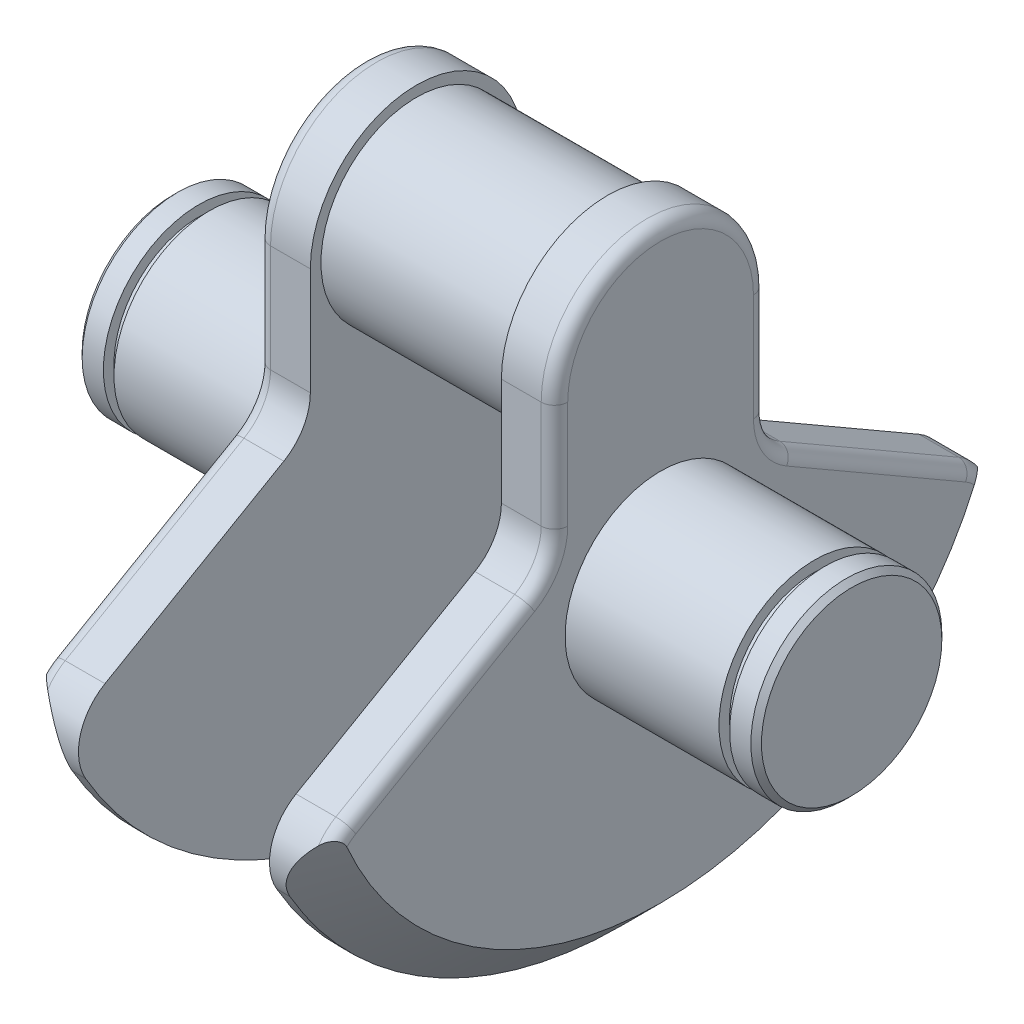
from build123d import *

# Parameters (mm, degrees)
BOSS_EXTRUDE1_DEPTH      = 10
CHAMFER1_SIZE            = 7.5
FILLET1_R                = 2.5
BOSS_EXTRUDE2_DEPTH      = 10
CHAMFER2_SIZE            = 7.5
FILLET2_R                = 2.5
SKETCH3_R                = 18
BOSS_EXTRUDE3_DEPTH      = 18
SKETCH4_R                = 18
BOSS_EXTRUDE4_DEPTH      = 36
SKETCH5_W                = 2
SKETCH5_H                = 2
CHAMFER3_SIZE            = 1
CHAMFER3_OF_MIRROR1_SIZE = 1


with BuildPart() as part:
    # Sketch1 → Boss-Extrude1 (new body)
    with BuildSketch(Plane(origin=(18, 0, 0), x_dir=(0, 0, -1), z_dir=(1, 0, 0))):
        with BuildLine():
            Line((-25, -28.886751346), (-58.693575035, -48.339745962))
            ThreePointArc((-58.693575035, -48.339745962), (-63.352833298, -54.411809549), (-62.353829072, -62))
            ThreePointArc((-62.353829072, -62), (0, -98), (62.353829072, -62))
            ThreePointArc((62.353829072, -62), (63.352833298, -54.411809549), (58.693575035, -48.339745962))
            Line((58.693575035, -48.339745962), (25, -28.886751346))
            ThreePointArc((25, -28.886751346), (21.339745962, -25.226497308), (20, -20.226497308))
            Line((20, -20.226497308), (20, 0))
            ThreePointArc((20, 0), (0, 20), (-20, 0))
            Line((-20, 0), (-20, -20.226497308))
            ThreePointArc((-20, -20.226497308), (-21.339745962, -25.226497308), (-25, -28.886751346))
        make_face()
    extrude(amount=BOSS_EXTRUDE1_DEPTH)

    # Chamfer1
    # the kernel refuses this chamfer: 7.5 mm, written as the material it takes off along each edge
    with BuildSketch(Plane(origin=(28, -26, 0), x_dir=(0, -0.2527522173180771, 0.9675310416936479), z_dir=(0, 0.9675310416936479, 0.2527522173180771))) as chamfer1_piece_1:
        Polygon((72, -CHAMFER1_SIZE), (72 - CHAMFER1_SIZE, 0), (72, 0), align=None)
    revolve(axis=Axis((28, -26, 0), (1, 0, 0)), revolution_arc=150.719131607, mode=Mode.SUBTRACT)

    # Fillet1
    fillet1_edges = [part.edges().sort_by_distance(p)[0] for p in [
        (28, -48.810655601, -59.432445857),
        (28, -38.613248654, -41.846787517),
        (28, -25.226497308, -21.339745962),
        (28, -10.113248654, -20),
        (28, -48.810655601, 59.432445857),
        (28, -38.613248654, 41.846787517),
        (28, -25.226497308, 21.339745962),
        (28, -10.113248654, 20),
        (28, 20, 0),
    ]]
    fillet(fillet1_edges, radius=FILLET1_R)



with BuildPart() as body_2:
    # Sketch2 → Boss-Extrude2 (new body)
    with BuildSketch(Plane(origin=(-18, 0, 0), x_dir=(0, 0, -1), z_dir=(1, 0, 0))):
        with BuildLine():
            Line((20, -20.226497308), (20, 0))
            ThreePointArc((20, 0), (0, 20), (-20, 0))
            Line((-20, 0), (-20, -20.226497308))
            ThreePointArc((-20, -20.226497308), (-21.339745962, -25.226497308), (-25, -28.886751346))
            Line((-25, -28.886751346), (-58.693575035, -48.339745962))
            ThreePointArc((-58.693575035, -48.339745962), (-63.352833298, -54.411809549), (-62.353829072, -62))
            ThreePointArc((-62.353829072, -62), (0, -98), (62.353829072, -62))
            ThreePointArc((62.353829072, -62), (63.352833298, -54.411809549), (58.693575035, -48.339745962))
            Line((58.693575035, -48.339745962), (25, -28.886751346))
            ThreePointArc((25, -28.886751346), (21.339745962, -25.226497308), (20, -20.226497308))
        make_face()
    extrude(amount=-BOSS_EXTRUDE2_DEPTH)

    # Chamfer2
    # the kernel refuses this chamfer: 7.5 mm, written as the material it takes off along each edge
    with BuildSketch(Plane(origin=(-28, -26, 0), x_dir=(0, -0.25275221731807723, 0.9675310416936479), z_dir=(0, 0.9675310416936479, 0.25275221731807723))) as chamfer2_piece_1:
        Polygon((72, CHAMFER2_SIZE), (72 - CHAMFER2_SIZE, 0), (72, 0), align=None)
    revolve(axis=Axis((-28, -26, 0), (1, 0, 0)), revolution_arc=150.719131607, mode=Mode.SUBTRACT)

    # Fillet2
    fillet2_edges = [body_2.edges().sort_by_distance(p)[0] for p in [
        (-28, -48.810655601, -59.432445857),
        (-28, -38.613248654, -41.846787517),
        (-28, -25.226497308, -21.339745962),
        (-28, -10.113248654, -20),
        (-28, -48.810655601, 59.432445857),
        (-28, -38.613248654, 41.846787517),
        (-28, -25.226497308, 21.339745962),
        (-28, -10.113248654, 20),
        (-28, 20, 0),
    ]]
    fillet(fillet2_edges, radius=FILLET2_R)


with BuildPart() as part_1:
    add(part.part)

    add(body_2.part)  # Boss-Extrude3 merges body 2
    # Sketch3 → Boss-Extrude3 (add, symmetric)
    with BuildSketch(Plane(origin=(0, 0, 0), x_dir=(0, 0, -1), z_dir=(1, 0, 0))):
        Circle(SKETCH3_R)
    extrude(amount=BOSS_EXTRUDE3_DEPTH, both=True)

    # Sketch4 → Boss-Extrude4 (add)
    with BuildSketch(Plane(origin=(28, 0, 0), x_dir=(0, 0, -1), z_dir=(1, 0, 0))):
        with Locations((0, -38)):
            Circle(SKETCH4_R)
    boss_extrude4 = extrude(amount=BOSS_EXTRUDE4_DEPTH)

    # Sketch5 → Cut-Revolve1 (revolve, cut)
    with BuildSketch(Plane.XY, mode=Mode.PRIVATE) as cut_revolve1_sk:
        with Locations((58, -21)):
            Rectangle(SKETCH5_W, SKETCH5_H)
    cut_revolve1 = revolve(cut_revolve1_sk.sketch.rotate(Axis((64, -38, 0), (-1, 0, 0)), 90), axis=Axis((64, -38, 0), (-1, 0, 0)), mode=Mode.SUBTRACT)

    # Chamfer3
    chamfer3_edges = [part_1.edges().sort_by_distance(p)[0] for p in [
        (64, -38, 18),
    ]]
    chamfer(chamfer3_edges, length=CHAMFER3_SIZE)

    # Mirror1: Boss-Extrude4, Cut-Revolve1 across plane
    add(boss_extrude4.mirror(Plane(origin=(0, 0, 0), x_dir=(0, 0, 1), z_dir=(1, 0, 0))))
    add(cut_revolve1.mirror(Plane(origin=(0, 0, 0), x_dir=(0, 0, 1), z_dir=(1, 0, 0))), mode=Mode.SUBTRACT)

    # Chamfer3 of Mirror1
    chamfer3_of_mirror1_edges = [part_1.edges().sort_by_distance(p)[0] for p in [
        (-64, -38, 18),
    ]]
    chamfer(chamfer3_of_mirror1_edges, length=CHAMFER3_OF_MIRROR1_SIZE)


solid = part_1.part
